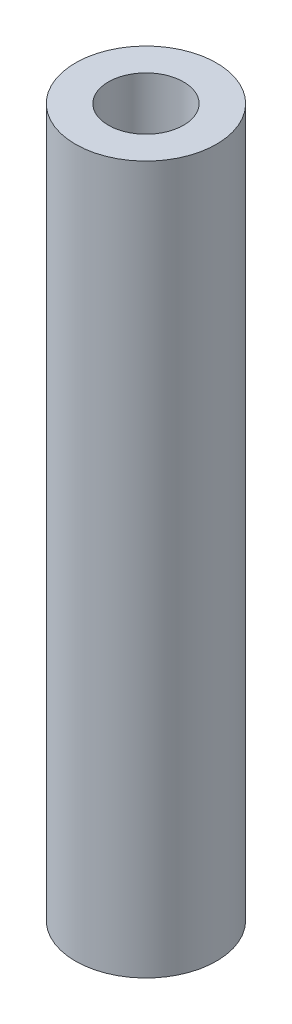
from build123d import *

# Parameters (mm, degrees)
SKETCH_1_R          = 7.5
EXTRUDE_1_DEPTH     = 75.26
SKETCH_3_R          = 4
CUT_EXTRUDE_1_DEPTH = 21.36


with BuildPart() as part:
    # 스케치1 → 보스-돌출1 (new body)
    with BuildSketch(Plane(origin=(0, 0, 0), x_dir=(1, 0, 0), z_dir=(0, 1, 0))):
        Circle(SKETCH_1_R)
    extrude(amount=-EXTRUDE_1_DEPTH)

    # 스케치3 → 컷-돌출1 (cut)
    with BuildSketch(Plane(origin=(0, 0, 0), x_dir=(1, 0, 0), z_dir=(0, 1, 0))):
        Circle(SKETCH_3_R)
    extrude(amount=-CUT_EXTRUDE_1_DEPTH, mode=Mode.SUBTRACT)


solid = part.part
